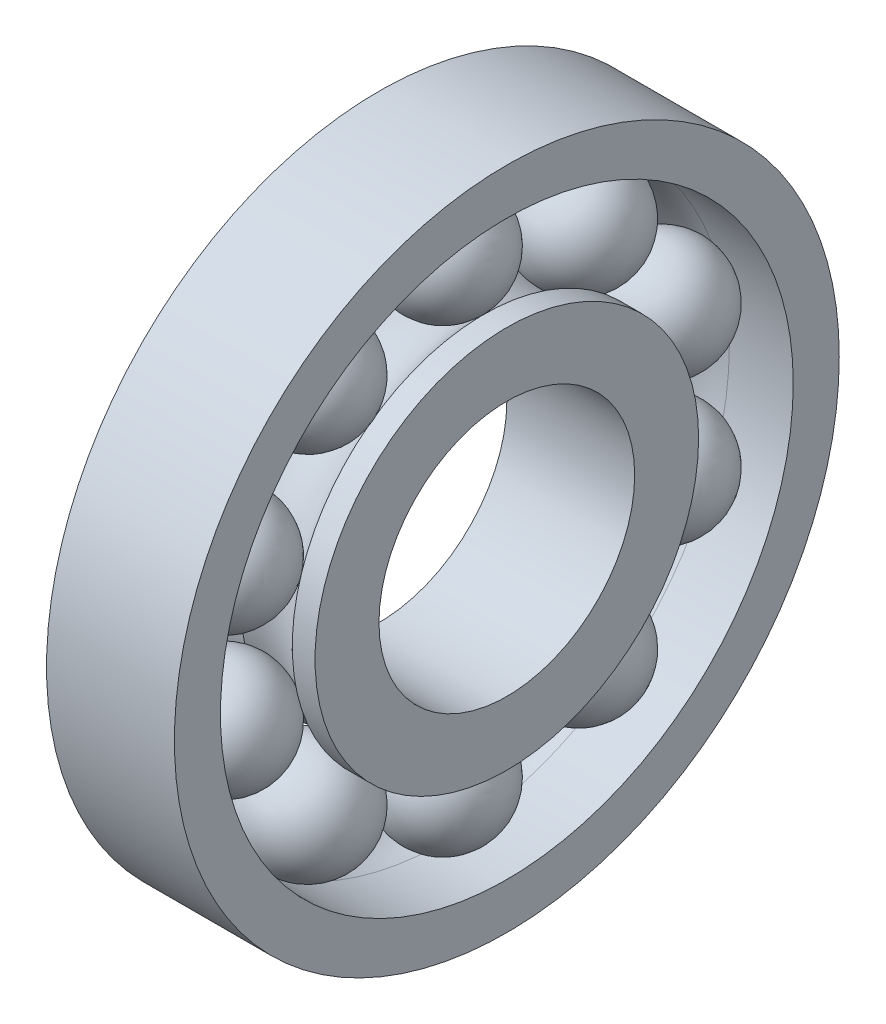
from build123d import *

# Parameters (mm, degrees)
CIRPATTERN2_COUNT = 10


# Read off the part's stored shape, not the designer's step: Revolve1
with BuildPart() as part:
    # Revolve1 outline → Revolve1 (revolve)
    with BuildSketch(Plane.YX):
        with BuildLine():
            Line((7.5, 4.109350958), (7.5, 5))
            Line((7.5, 5), (5, 5))
            Line((5, 5), (5, 0))
            Line((5, 0), (7, 0))
            Line((7, 0), (7, 1.583479129))
            ThreePointArc((7, 1.583479129), (6.841874164, 2.927204146), (7.5, 4.109350958))
        make_face()
        with BuildLine():
            Line((10.5, 0.890649042), (10.5, 0))
            Line((10.5, 0), (13, 0))
            Line((13, 0), (13, 5))
            Line((13, 5), (11.2, 5))
            Line((11.2, 5), (11.200002388, 2.5))
            ThreePointArc((11.200002388, 2.5), (11.017425846, 1.622501588), (10.5, 0.890649042))
        make_face()
    revolve(axis=Axis((0, 0, 0), (1, 0, 0)))


with BuildPart() as body_2:
    # Sketch1<3> one side → Revolve2 (revolve)
    with BuildSketch(Plane.XY):
        with BuildLine():
            ThreePointArc((2.5, 6.799997612), (4.055636607, 7.444363393), (4.700002388, 9))
            ThreePointArc((4.700002388, 9), (4.055636607, 10.555636607), (2.5, 11.200002388))
            Line((2.5, 11.200002388), (2.5, 6.799997612))
        make_face()
    revolve(axis=Axis((2.5, 13, 0), (0, -1, 0)))


with BuildPart() as cirpattern2_1:
    # CirPattern2: pattern copy
    add(body_2.part.rotate(Axis((0, 0, 0), (1, 0, 0)), 1 * 360 / CIRPATTERN2_COUNT))


with BuildPart() as cirpattern2_2:
    # CirPattern2: pattern copy
    add(body_2.part.rotate(Axis((0, 0, 0), (1, 0, 0)), 2 * 360 / CIRPATTERN2_COUNT))


with BuildPart() as cirpattern2_3:
    # CirPattern2: pattern copy
    add(body_2.part.rotate(Axis((0, 0, 0), (1, 0, 0)), 3 * 360 / CIRPATTERN2_COUNT))


with BuildPart() as cirpattern2_4:
    # CirPattern2: pattern copy
    add(body_2.part.rotate(Axis((0, 0, 0), (1, 0, 0)), 4 * 360 / CIRPATTERN2_COUNT))


with BuildPart() as cirpattern2_5:
    # CirPattern2: pattern copy
    add(body_2.part.rotate(Axis((0, 0, 0), (1, 0, 0)), 5 * 360 / CIRPATTERN2_COUNT))


with BuildPart() as cirpattern2_6:
    # CirPattern2: pattern copy
    add(body_2.part.rotate(Axis((0, 0, 0), (1, 0, 0)), 6 * 360 / CIRPATTERN2_COUNT))


with BuildPart() as cirpattern2_7:
    # CirPattern2: pattern copy
    add(body_2.part.rotate(Axis((0, 0, 0), (1, 0, 0)), 7 * 360 / CIRPATTERN2_COUNT))


with BuildPart() as cirpattern2_8:
    # CirPattern2: pattern copy
    add(body_2.part.rotate(Axis((0, 0, 0), (1, 0, 0)), 8 * 360 / CIRPATTERN2_COUNT))


with BuildPart() as cirpattern2_9:
    # CirPattern2: pattern copy
    add(body_2.part.rotate(Axis((0, 0, 0), (1, 0, 0)), 9 * 360 / CIRPATTERN2_COUNT))


solid = Compound([part.part, body_2.part, cirpattern2_1.part, cirpattern2_2.part, cirpattern2_3.part, cirpattern2_4.part, cirpattern2_5.part, cirpattern2_6.part, cirpattern2_7.part, cirpattern2_8.part, cirpattern2_9.part])
